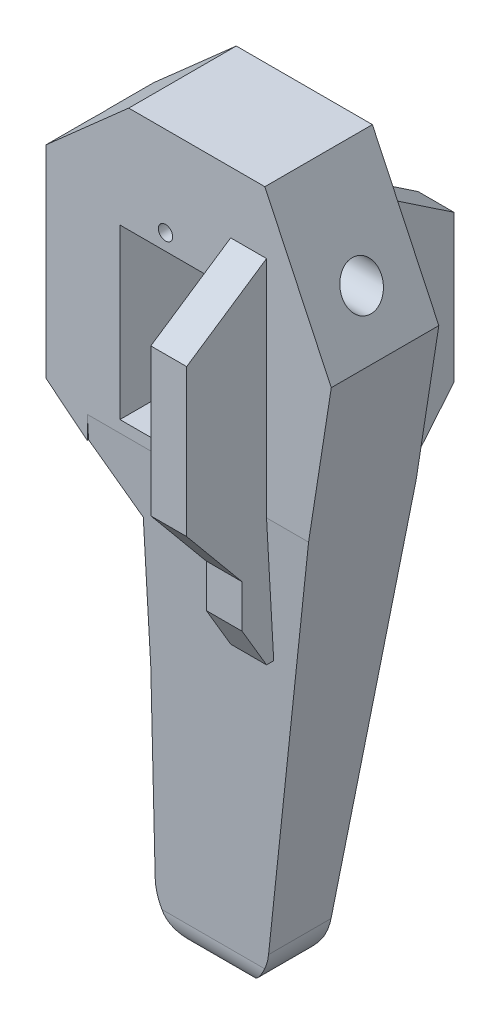
from build123d import *

# Parameters (mm, degrees)
SKETCH1_R                = 15
SKETCH1_W                = 14.5
SKETCH1_H                = 22.8
BOSS_EXTRUDE1_DEPTH      = 12
CUT_EXTRUDE1_DEPTH       = 24
BOSS_EXTRUDE2_START      = -12
BOSS_EXTRUDE2_DEPTH      = 12
FILLET1_R                = 5
FILLET2_R                = 5
BOSS_EXTRUDE4_DEPTH      = 12
BOSS_EXTRUDE7_DEPTH      = 10
SKETCH9_R                = 7.25
BOSS_EXTRUDE9_DEPTH      = 6.6
SKETCH10_R               = 2.5
BOSS_EXTRUDE10_DEPTH     = 3
FILLET3_R                = 10
FILLET5_R                = 10
SKETCH11_W               = 2.40686952
SKETCH11_H               = 3
SKETCH11_W_2             = 3
SKETCH11_H_2             = 2.40686952
CUT_EXTRUDE2_DEPTH       = 10
SKETCH13_W               = 18.18626096
SKETCH13_H               = 26.685750205
BOSS_EXTRUDE11_DEPTH     = 3.6
SKETCH15_W               = 18.18626096
SKETCH15_H               = 26.685750205
SKETCH15_W_2             = 14.5
SKETCH15_H_2             = 22.8
BOSS_EXTRUDE12_DEPTH     = 13.6
SKETCH17_W               = 88.544213988
SKETCH17_H               = 130.772992967
SKETCH17_W_2             = 18.18626096
SKETCH17_H_2             = 26.685750205
CUT_EXTRUDE3_DEPTH       = 13.6
BOSS_EXTRUDE16_DEPTH     = 15
CUT_EXTRUDE6_DEPTH       = 20
CUT_EXTRUDE6_DEPTH_BACK  = 20
BOSS_EXTRUDE17_DEPTH     = 5
CUT_EXTRUDE7_DEPTH       = 25
CUT_EXTRUDE7_DEPTH_BACK  = 15
SKETCH25_W               = 14.18626096
SKETCH25_H               = 22.685750205
CUT_EXTRUDE8_DEPTH       = 20
SKETCH26_R               = 1
CUT_EXTRUDE9_DEPTH       = 3
CUT_EXTRUDE12_DEPTH      = 25
SKETCH29_W               = 13.770233496
SKETCH29_H               = 29.611444499
CUT_EXTRUDE13_DEPTH      = 48
SKETCH30_W               = 12
SKETCH30_H               = 22.8
CUT_EXTRUDE14_DEPTH      = 48
SKETCH32_W               = 2
SKETCH32_H               = 22.8
BOSS_EXTRUDE23_DEPTH     = 17
SKETCH33_W               = 15.85
SKETCH33_H               = 2
BOSS_EXTRUDE24_DEPTH     = 4
SKETCH34_W               = 15.85
SKETCH34_H               = 26.8
BOSS_EXTRUDE25_DEPTH     = 3
SKETCH35_R               = 5.925
BOSS_EXTRUDE26_DEPTH     = 4.8
SKETCH36_R               = 2.5
BOSS_EXTRUDE27_DEPTH     = 3
SKETCH37_W               = 12.7
SKETCH37_H               = 23.5
CUT_EXTRUDE15_DEPTH      = 63
CUT_EXTRUDE16_DEPTH      = 8
CUT_EXTRUDE16_DEPTH_BACK = 4
SKETCH38_W               = 9
SKETCH38_H               = 3
CUT_EXTRUDE17_DEPTH      = 5
CUT_EXTRUDE18_DEPTH      = 31
CUT_EXTRUDE18_DEPTH_BACK = 50
SKETCH40_R               = 2.75


# Read off the part's stored shape, not the designer's step: Boss-Extrude2
with BuildPart() as part:
    # Sketch1 → Boss-Extrude1 (new body)
    # profile 1 of 2: a face of its own
    with BuildSketch(Plane.XY):
        Circle(SKETCH1_R)
        Rectangle(SKETCH1_W, SKETCH1_H, mode=Mode.SUBTRACT)
    # profile 2 of 2: a face of its own
    with BuildSketch(Plane.XY):
        with BuildLine():
            Line((34.889014039, -14.726662295), (10.829823077, 10.378580449))
            ThreePointArc((10.829823077, 10.378580449), (13.918465184, 5.5925242), (15, 0))
            ThreePointArc((15, 0), (8.274705986, -12.511164648), (-5.870565447, -13.803494533))
            Line((-5.870565447, -13.803494533), (11.720818789, -21.285032793))
            Line((11.720818789, -21.285032793), (7.17598603, -56.938690475))
            Line((7.17598603, -56.938690475), (22.17598603, -56.938690475))
            Line((22.17598603, -56.938690475), (34.889014039, -14.726662295))
        make_face()
    extrude(amount=BOSS_EXTRUDE1_DEPTH)

    # Sketch4 → Cut-Extrude1 (cut)
    with BuildSketch(Plane.XY.offset(12)):
        Polygon((25.908479053, -5.355669266), (45.608770936, -16.450233145), (32.401525551, -58.978549805), (15.005502416, -56.938690475), align=None)
    extrude(amount=-CUT_EXTRUDE1_DEPTH, mode=Mode.SUBTRACT)

    # Boss-Extrude2 outline → Boss-Extrude2 (add)
    with BuildSketch(Plane.XY.offset(12).offset(BOSS_EXTRUDE2_START)):
        with BuildLine():
            Line((5.606806504, -22.40394756), (1.154595891, -56.938690475))
            Line((1.154595891, -56.938690475), (7.17598603, -56.938690475))
            Line((7.17598603, -56.938690475), (11.720818789, -21.285032793))
            Line((11.720818789, -21.285032793), (-5.870565447, -13.803494533))
            ThreePointArc((-5.870565447, -13.803494533), (-7.327726293, -13.088331726), (-8.699078631, -12.219903066))
            Line((-8.699078631, -12.219903066), (5.606806504, -22.40394756))
        make_face()
    extrude(amount=BOSS_EXTRUDE2_DEPTH)

    # Fillet1
    fillet1_edges = [part.edges().sort_by_distance(p)[0] for p in [
        (1.154595891, -56.938690475, 6),
    ]]
    fillet(fillet1_edges, radius=FILLET1_R)

    # Fillet2
    fillet2_edges = [part.edges().sort_by_distance(p)[0] for p in [
        (15.005502416, -56.938690475, 6),
    ]]
    fillet(fillet2_edges, radius=FILLET2_R)

    # Sketch5 → Boss-Extrude4 (add)
    with BuildSketch(Plane(origin=(0, 0, 0), x_dir=(-1, 0, 0), z_dir=(0, 0, -1))):
        with BuildLine():
            Line((-2.448312302, -26.293012267), (11.598771509, -16.293204089))
            ThreePointArc((11.598771509, -16.293204089), (15.246223493, 12.944213735), (-14.195603849, 14.088464479))
            Line((-14.195603849, 14.088464479), (-32.784425655, -4.641720828))
            Line((-32.784425655, -4.641720828), (-16.822475194, -80.159229174))
            Line((-16.822475194, -80.159229174), (4.496107211, -80.159229174))
            Line((4.496107211, -80.159229174), (-2.448312302, -26.293012267))
        make_face()
        with BuildLine():
            Line((-25.908479053, -5.355669266), (-10.829823077, 10.378580449))
            ThreePointArc((-10.829823077, 10.378580449), (11.349356029, 9.807758038), (8.699078632, -12.219903067))
            Line((8.699078631, -12.219903066), (-5.606806504, -22.40394756))
            Line((-5.606806504, -22.40394756), (-1.88161409, -51.29938255))
            ThreePointArc((-1.88161409, -51.29938255), (-3.085807921, -55.240467298), (-6.8405742, -56.938690475))
            Line((-6.8405742, -56.938690475), (-10.951869916, -56.938690475))
            ThreePointArc((-10.951869916, -56.938690475), (-14.100682132, -55.822629407), (-15.843787659, -52.972683126))
            Line((-15.843787659, -52.972683126), (-25.908479053, -5.355669266))
        make_face(mode=Mode.SUBTRACT)
    extrude(amount=-BOSS_EXTRUDE4_DEPTH)

    # Sketch6 → Boss-Extrude7 (add)
    with BuildSketch(Plane(origin=(0, 0, 0), x_dir=(-1, 0, 0), z_dir=(0, 0, -1))):
        Polygon((-11.5, 2.65), (-7.25, 2.65), (-7.25, 4.15), (-7.25, 5.65), (-11.5, 5.65), align=None)
        with BuildLine():
            Line((-7.25, 2.65), (-7.09313048, 2.65))
            ThreePointArc((-7.09313048, 2.65), (-7.210675973, 3.395909812), (-7.25, 4.15))
            Line((-7.25, 4.15), (-7.25, 2.65))
        make_face()
        with BuildLine():
            Line((-7.25, 5.65), (-7.25, 4.15))
            ThreePointArc((-7.25, 4.15), (-7.210675973, 4.904090188), (-7.09313048, 5.65))
            Line((-7.09313048, 5.65), (-7.25, 5.65))
        make_face()
        Polygon((0, 11.4), (1.5, 11.4), (1.5, 15.65), (-1.5, 15.65), (-1.5, 11.4), align=None)
        with BuildLine():
            Line((-1.5, 11.4), (-1.5, 11.24313048))
            ThreePointArc((-1.5, 11.24313048), (-0.754090188, 11.360675973), (0, 11.4))
            Line((0, 11.4), (-1.5, 11.4))
        make_face()
        with BuildLine():
            ThreePointArc((0, 11.4), (0.754090188, 11.360675973), (1.5, 11.24313048))
            Line((1.5, 11.24313048), (1.5, 11.4))
            Line((1.5, 11.4), (0, 11.4))
        make_face()
        Polygon((7.25, 4.15), (7.25, 2.65), (11.5, 2.65), (11.5, 5.65), (7.25, 5.65), align=None)
        with BuildLine():
            ThreePointArc((7.09313048, 5.65), (7.210675973, 4.904090188), (7.25, 4.15))
            Line((7.25, 4.15), (7.25, 5.65))
            Line((7.25, 5.65), (7.09313048, 5.65))
        make_face()
        with BuildLine():
            ThreePointArc((7.25, 4.15), (7.210675973, 3.395909812), (7.09313048, 2.65))
            Line((7.09313048, 2.65), (7.25, 2.65))
            Line((7.25, 2.65), (7.25, 4.15))
        make_face()
    extrude(amount=BOSS_EXTRUDE7_DEPTH)

    # Sketch9 → Boss-Extrude9 (add)
    with BuildSketch(Plane(origin=(0, 0, -6.4), x_dir=(-1, 0, 0), z_dir=(0, 0, -1))):
        with Locations(Location((0, 4.15, 0), (0, 0, 168.059456039))):
            Circle(SKETCH9_R)
    extrude(amount=BOSS_EXTRUDE9_DEPTH)

    # Sketch10 → Boss-Extrude10 (add)
    with BuildSketch(Plane(origin=(0, 0, -13), x_dir=(-1, 0, 0), z_dir=(0, 0, -1))):
        with Locations((0, 4.15)):
            Circle(SKETCH10_R)
    extrude(amount=BOSS_EXTRUDE10_DEPTH)

    # Fillet3
    fillet3_edges = [part.edges().sort_by_distance(p)[0] for p in [
        (-4.496107211, -80.159229174, 6),
    ]]
    fillet(fillet3_edges, radius=FILLET3_R)

    # Fillet5
    fillet5_edges = [part.edges().sort_by_distance(p)[0] for p in [
        (16.822475194, -80.159229174, 6),
    ]]
    fillet(fillet5_edges, radius=FILLET5_R)

    # Sketch11 → Cut-Extrude2 (cut)
    with BuildSketch(Plane(origin=(0, 0, -10), x_dir=(-1, 0, 0), z_dir=(0, 0, -1))):
        with Locations((10.29656524, 4.15)):
            Rectangle(SKETCH11_W, SKETCH11_H)
        with Locations((-10.29656524, 4.15)):
            Rectangle(SKETCH11_W, SKETCH11_H)
        with Locations((0, 14.44656524)):
            Rectangle(SKETCH11_W_2, SKETCH11_H_2)
    extrude(amount=-CUT_EXTRUDE2_DEPTH, mode=Mode.SUBTRACT)

    # Sketch13 → Boss-Extrude11 (add)
    with BuildSketch(Plane(origin=(0, 0, -10), x_dir=(-1, 0, 0), z_dir=(0, 0, -1))):
        with Locations((0, -0.057124897)):
            Rectangle(SKETCH13_W, SKETCH13_H)
    extrude(amount=-BOSS_EXTRUDE11_DEPTH)

    # Sketch15 → Boss-Extrude12 (add)
    with BuildSketch(Plane(origin=(0, 0, -10), x_dir=(-1, 0, 0), z_dir=(0, 0, -1))):
        with Locations((0, -0.057124897)):
            Rectangle(SKETCH15_W, SKETCH15_H)
        Rectangle(SKETCH15_W_2, SKETCH15_H_2, mode=Mode.SUBTRACT)
    extrude(amount=-BOSS_EXTRUDE12_DEPTH)

    # Sketch17 → Cut-Extrude3 (cut)
    with BuildSketch(Plane(origin=(0, 0, 0), x_dir=(-1, 0, 0), z_dir=(0, 0, -1))):
        with Locations((-15.076356892, -26.777764381)):
            Rectangle(SKETCH17_W, SKETCH17_H)
        with Locations((0, -0.057124897)):
            Rectangle(SKETCH17_W_2, SKETCH17_H_2, mode=Mode.SUBTRACT)
    extrude(amount=-CUT_EXTRUDE3_DEPTH, mode=Mode.SUBTRACT)

    # Sketch18 → Boss-Extrude16 (add)
    with BuildSketch(Plane.XY.offset(12)):
        with BuildLine():
            Line((11.233307191, -69.15695845), (23.12256473, 6.835135095))
            Line((23.12256473, 6.835135095), (13.856935522, 26.481884794))
            Line((13.856935522, 26.481884794), (-5.128379784, 26.481884794))
            Line((-5.128379784, 26.481884794), (-16.662343589, 16.28148622))
            Line((-16.662343589, 16.28148622), (-16.662343589, -11.932277882))
            Line((-16.662343589, -11.932277882), (-3.607666978, -22.42507862))
            Line((-3.607666978, -22.42507862), (-3.607666978, -41.0028204))
            Line((-3.607666978, -41.0028204), (-4.500106941, -67.747530096))
            ThreePointArc((-4.500106941, -67.747530096), (-2.395287871, -73.211774888), (2.995720994, -75.497657186))
            Line((2.995720994, -75.497657186), (3.823447504, -75.497657186))
            ThreePointArc((3.823447504, -75.497657186), (8.699677632, -73.696111339), (11.233307191, -69.15695845))
        make_face()
    extrude(amount=-BOSS_EXTRUDE16_DEPTH)

    # Sketch22 → Cut-Extrude6 (cut, two sides: drawn at the far end of the back side and taken through both)
    with BuildSketch(Plane(origin=(9.09313048, 0, 0), x_dir=(0, 0, -1), z_dir=(1, 0, 0)).offset(-CUT_EXTRUDE6_DEPTH_BACK)):
        Polygon((-0.5, -75.497657186), (-8.5, -75.497657186), (-12, -13.4), (-17.601804557, -13.4), (-17.601804557, -86.596912876), (8.601804557, -86.596912876), (8.601804557, -13.4), (3, -13.4), align=None)
    extrude(amount=CUT_EXTRUDE6_DEPTH + CUT_EXTRUDE6_DEPTH_BACK, mode=Mode.SUBTRACT)

    # Sketch20 → Boss-Extrude17 (add)
    with BuildSketch(Plane(origin=(9.09313048, 0, 0), x_dir=(0, 0, -1), z_dir=(1, 0, 0))):
        Polygon((3, 17.918244511), (14.141754599, 10.438791043), (14.141754599, -10.090778273), (6.4, -19.427119201), (6.4, -25.402377395), (3, -31.160911677), (-12, -31.160911677), (-15.4, -25.402377395), (-15.4, -19.427119201), (-23.141754599, -10.090778273), (-23.141754599, 10.438791043), (-12, 17.918244511), align=None)
    extrude(amount=BOSS_EXTRUDE17_DEPTH)

    # Sketch24 → Cut-Extrude7 (cut, two sides: drawn at the far end of the back side and taken through both)
    with BuildSketch(Plane(origin=(0, 0, 0), x_dir=(0, 0, -1), z_dir=(1, 0, 0)).offset(-CUT_EXTRUDE7_DEPTH_BACK)):
        with BuildLine():
            Line((-8.73179984, -71.265857346), (-10.447221895, -71.265857346))
            Line((-10.447221895, -71.265857346), (-10.447221895, -79.091973424))
            Line((-10.447221895, -79.091973424), (1.689879503, -79.091973424))
            Line((1.689879503, -79.091973424), (1.689879503, -71.265857346))
            Line((1.689879503, -71.265857346), (-0.26820016, -71.265857346))
            ThreePointArc((-0.26820016, -71.265857346), (-4.5, -75.497657186), (-8.73179984, -71.265857346))
        make_face()
    extrude(amount=CUT_EXTRUDE7_DEPTH + CUT_EXTRUDE7_DEPTH_BACK, mode=Mode.SUBTRACT)

    # Sketch25 → Cut-Extrude8 (cut)
    with BuildSketch(Plane.XY.offset(12)):
        with Locations((0, -0.057124897)):
            Rectangle(SKETCH25_W, SKETCH25_H)
    extrude(amount=-CUT_EXTRUDE8_DEPTH, mode=Mode.SUBTRACT)

    # Sketch26 → Cut-Extrude9 (cut)
    with BuildSketch(Plane.XY.offset(12)):
        with Locations((0, 14)):
            Circle(SKETCH26_R)
        with Locations(Location((0, -14, 0), (0, 0, 36.869897646))):
            Circle(SKETCH26_R)
    extrude(amount=-CUT_EXTRUDE9_DEPTH, mode=Mode.SUBTRACT)

    # Sketch27 → Cut-Extrude12 (cut)
    with BuildSketch(Plane.ZY.offset(16.662343589)):
        Polygon((0, -22.42507862), (2.55450185, -67.747530096), (6.44549815, -67.747530096), (9, -22.42507862), (9, -11.932277882), (0, -11.932277882), align=None)
    extrude(amount=-CUT_EXTRUDE12_DEPTH, mode=Mode.SUBTRACT)

    # Sketch29 → Cut-Extrude13 (cut)
    with BuildSketch(Plane.ZY.offset(-9.09313048)):
        with Locations((-9.885116748, -0.309323441)):
            Rectangle(SKETCH29_W, SKETCH29_H)
    extrude(amount=CUT_EXTRUDE13_DEPTH, mode=Mode.SUBTRACT)

    # Sketch30 → Cut-Extrude14 (cut)
    with BuildSketch(Plane.XY.offset(12)):
        Rectangle(SKETCH30_W, SKETCH30_H)
    extrude(amount=-CUT_EXTRUDE14_DEPTH, mode=Mode.SUBTRACT)

    # Sketch32 → Boss-Extrude23 (add)
    with BuildSketch(Plane.XY.offset(12)):
        Polygon((-5.925, 11.4), (-7.925, 11.4), (-7.925, 9.4), (-7.925, -11.4), (-5.925, -11.4), align=None)
        with Locations((6.925, 0)):
            Rectangle(SKETCH32_W, SKETCH32_H)
    extrude(amount=-BOSS_EXTRUDE23_DEPTH)

    # Sketch33 → Boss-Extrude24 (add)
    with BuildSketch(Plane(origin=(0, 0, -5), x_dir=(-1, 0, 0), z_dir=(0, 0, -1))):
        with Locations((0, 12.4)):
            Rectangle(SKETCH33_W, SKETCH33_H)
        with Locations((0, -12.4)):
            Rectangle(SKETCH33_W, SKETCH33_H)
    extrude(amount=-BOSS_EXTRUDE24_DEPTH)

    # Sketch34 → Boss-Extrude25 (add)
    with BuildSketch(Plane(origin=(0, 0, -5), x_dir=(-1, 0, 0), z_dir=(0, 0, -1))):
        Rectangle(SKETCH34_W, SKETCH34_H)
    extrude(amount=BOSS_EXTRUDE25_DEPTH)

    # Sketch35 → Boss-Extrude26 (add)
    with BuildSketch(Plane(origin=(0, 0, -8), x_dir=(-1, 0, 0), z_dir=(0, 0, -1))):
        with Locations((0, 5.47)):
            Circle(SKETCH35_R)
    extrude(amount=BOSS_EXTRUDE26_DEPTH)

    # Sketch36 → Boss-Extrude27 (add)
    with BuildSketch(Plane(origin=(0, 0, -12.8), x_dir=(-1, 0, 0), z_dir=(0, 0, -1))):
        with Locations((0, 5.47)):
            Circle(SKETCH36_R)
    extrude(amount=BOSS_EXTRUDE27_DEPTH)

    # Sketch37 → Cut-Extrude15 (cut)
    with BuildSketch(Plane.XY.offset(-5)):
        Rectangle(SKETCH37_W, SKETCH37_H)
    extrude(amount=CUT_EXTRUDE15_DEPTH, mode=Mode.SUBTRACT)

    # Sketch38 → Cut-Extrude16 (cut, two sides: drawn at the far end of the back side and taken through both)
    with BuildSketch(Plane.XY.offset(-5).offset(-CUT_EXTRUDE16_DEPTH_BACK)):
        with Locations((0, 11.75)):
            Rectangle(SKETCH38_W, SKETCH38_H)
    extrude(amount=CUT_EXTRUDE16_DEPTH + CUT_EXTRUDE16_DEPTH_BACK, mode=Mode.SUBTRACT)

    # Sketch39 → Cut-Extrude17 (cut)
    with BuildSketch(Plane(origin=(0, 0, -8), x_dir=(-1, 0, 0), z_dir=(0, 0, -1))):
        Polygon((4.5, 13.25), (7.925, 10.934007287), (7.925, 7.934007287), (4.5, 10.25), align=None)
    extrude(amount=-CUT_EXTRUDE17_DEPTH, mode=Mode.SUBTRACT)

    # Sketch40 → Cut-Extrude18 (cut, two sides: drawn at the far end of the back side and taken through both)
    with BuildSketch(Plane(origin=(14.09313048, 0, 0), x_dir=(0, 0, -1), z_dir=(1, 0, 0)).offset(-CUT_EXTRUDE18_DEPTH_BACK)):
        with Locations(Location((-4.5, 13.768011552, 0), (0, 0, 66.062809756))):
            Circle(SKETCH40_R)
    extrude(amount=CUT_EXTRUDE18_DEPTH + CUT_EXTRUDE18_DEPTH_BACK, mode=Mode.SUBTRACT)


solid = part.part
